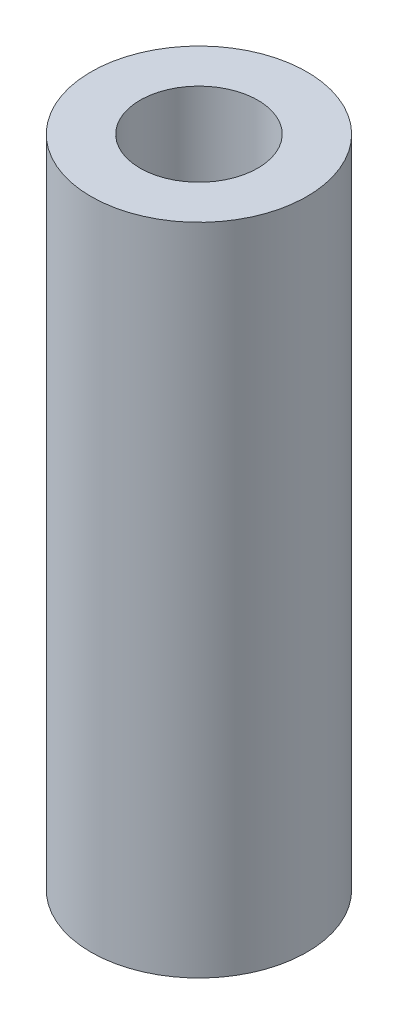
from build123d import *

# Parameters (mm, degrees)
SKETCH1_R           = 3.3
SKETCH1_R_2         = 1.8
BOSS_EXTRUDE1_DEPTH = 20


with BuildPart() as part:
    # Sketch1 → Boss-Extrude1 (new body)
    with BuildSketch(Plane(origin=(0, 0, 0), x_dir=(1, 0, 0), z_dir=(0, 1, 0))):
        Circle(SKETCH1_R)
        Circle(SKETCH1_R_2, mode=Mode.SUBTRACT)
    extrude(amount=BOSS_EXTRUDE1_DEPTH)


solid = part.part
